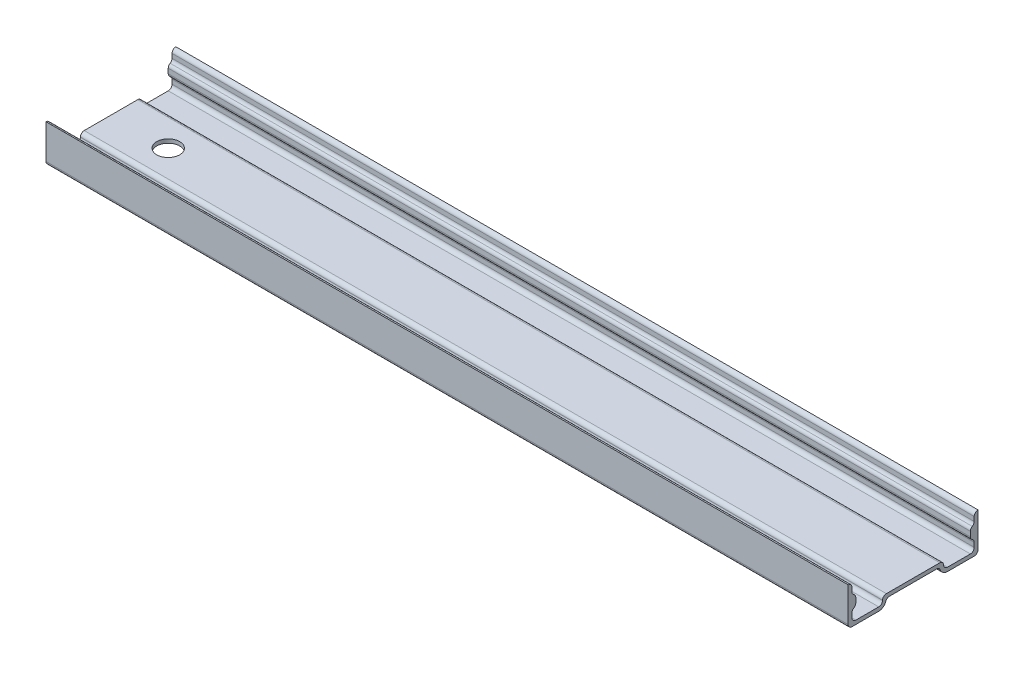
from build123d import *

# Parameters (mm, degrees)
SKETCH1_W           = 210
SKETCH1_H           = 34
BOSS_EXTRUDE1_DEPTH = 1
SKETCH2_W           = 210
SKETCH2_H           = 1
BOSS_EXTRUDE2_DEPTH = 9
SKETCH3_W           = 210
SKETCH3_H           = 16
BOSS_EXTRUDE3_DEPTH = 2
FILLET1_R           = 1
FILLET2_R           = 1
FILLET3_R           = 1
FILLET4_R           = 1
FILLET5_R           = 1
FILLET6_R           = 1
CUT_EXTRUDE1_DEPTH  = 211.924156985
FILLET7_R           = 1
FILLET8_R           = 1
FILLET9_R           = 1
FILLET10_R          = 1
SKETCH5_W           = 3
SKETCH5_H           = 3
BOSS_EXTRUDE4_DEPTH = 210
FILLET11_R          = 1
FILLET12_R          = 1
FILLET13_R          = 1
FILLET14_R          = 1
FILLET15_R          = 1
FILLET16_R          = 1
FILLET17_R          = 1
FILLET18_R          = 1
SKETCH6_W           = 1
SKETCH6_H           = 3
CUT_EXTRUDE2_DEPTH  = 210
SKETCH7_R           = 3
CUT_EXTRUDE3_DEPTH  = 10


with BuildPart() as part:
    # Sketch1 → Boss-Extrude1 (new body)
    with BuildSketch(Plane(origin=(0, 0, 0), x_dir=(1, 0, 0), z_dir=(0, 1, 0))):
        Rectangle(SKETCH1_W, SKETCH1_H)
    extrude(amount=BOSS_EXTRUDE1_DEPTH)

    # Sketch2 → Boss-Extrude2 (add)
    with BuildSketch(Plane(origin=(0, 1, 0), x_dir=(1, 0, 0), z_dir=(0, 1, 0))):
        with Locations((0, 16.5)):
            Rectangle(SKETCH2_W, SKETCH2_H)
        with Locations((0, -16.5)):
            Rectangle(SKETCH2_W, SKETCH2_H)
    extrude(amount=BOSS_EXTRUDE2_DEPTH)

    # Sketch3 → Boss-Extrude3 (add)
    with BuildSketch(Plane(origin=(0, 1, 0), x_dir=(1, 0, 0), z_dir=(0, 1, 0))):
        Rectangle(SKETCH3_W, SKETCH3_H)
    extrude(amount=BOSS_EXTRUDE3_DEPTH)

    # Fillet1
    fillet1_edges = [part.edges().sort_by_distance(p)[0] for p in [
        (0, 1, 8),
    ]]
    fillet(fillet1_edges, radius=FILLET1_R)

    # Fillet2
    fillet2_edges = [part.edges().sort_by_distance(p)[0] for p in [
        (0, 1, -8),
    ]]
    fillet(fillet2_edges, radius=FILLET2_R)

    # Fillet3
    fillet3_edges = [part.edges().sort_by_distance(p)[0] for p in [
        (0, 1, 16),
    ]]
    fillet(fillet3_edges, radius=FILLET3_R)

    # Fillet4
    fillet4_edges = [part.edges().sort_by_distance(p)[0] for p in [
        (0, 1, -16),
    ]]
    fillet(fillet4_edges, radius=FILLET4_R)

    # Fillet5
    fillet5_edges = [part.edges().sort_by_distance(p)[0] for p in [
        (0, 10, -16),
    ]]
    fillet(fillet5_edges, radius=FILLET5_R - 0.0001)  # a hair under: the kernel refuses the full size

    # Fillet6
    fillet6_edges = [part.edges().sort_by_distance(p)[0] for p in [
        (0, 10, 16),
    ]]
    fillet(fillet6_edges, radius=FILLET6_R - 0.0001)  # a hair under: the kernel refuses the full size

    # Sketch4 → Cut-Extrude1 (cut, through all)
    with BuildSketch(Plane(origin=(105, 0, 0), x_dir=(0, 0, -1), z_dir=(1, 0, 0))):
        with BuildLine():
            Line((-9, 0), (9, 0))
            ThreePointArc((9, 0), (7.845299462, 0.367006838), (7.114381917, 1.333333333))
            ThreePointArc((7.114381917, 1.333333333), (6.748923144, 1.816496581), (6.171572875, 2))
            Line((6.171572875, 2), (-6.171572875, 2))
            ThreePointArc((-6.171572875, 2), (-6.748923144, 1.816496581), (-7.114381917, 1.333333333))
            ThreePointArc((-7.114381917, 1.333333333), (-7.845299462, 0.367006838), (-9, 0))
        make_face()
    extrude(amount=-CUT_EXTRUDE1_DEPTH, mode=Mode.SUBTRACT)

    # Fillet7
    fillet7_edges = [part.edges().sort_by_distance(p)[0] for p in [
        (0, 3, 8),
    ]]
    fillet(fillet7_edges, radius=FILLET7_R - 0.0001)  # a hair under: the kernel refuses the full size

    # Fillet8
    fillet8_edges = [part.edges().sort_by_distance(p)[0] for p in [
        (0, 3, -8),
    ]]
    fillet(fillet8_edges, radius=FILLET8_R - 0.0001)  # a hair under: the kernel refuses the full size

    # Fillet9
    fillet9_edges = [part.edges().sort_by_distance(p)[0] for p in [
        (0, 0, -17),
    ]]
    fillet(fillet9_edges, radius=FILLET9_R)

    # Fillet10
    fillet10_edges = [part.edges().sort_by_distance(p)[0] for p in [
        (0, 0, 17),
    ]]
    fillet(fillet10_edges, radius=FILLET10_R)

    # Sketch5 → Boss-Extrude4 (add)
    with BuildSketch(Plane(origin=(105, 0, 0), x_dir=(0, 0, -1), z_dir=(1, 0, 0))):
        with Locations((-16.5, 5.371770908)):
            Rectangle(SKETCH5_W, SKETCH5_H)
        with Locations((16.5, 5.371770908)):
            Rectangle(SKETCH5_W, SKETCH5_H)
    extrude(amount=-BOSS_EXTRUDE4_DEPTH)

    # Fillet11
    fillet11_edges = [part.edges().sort_by_distance(p)[0] for p in [
        (0, 6.871770908, 16),
    ]]
    fillet(fillet11_edges, radius=FILLET11_R - 0.0001)  # a hair under: the kernel refuses the full size

    # Fillet12
    fillet12_edges = [part.edges().sort_by_distance(p)[0] for p in [
        (0, 6.871770908, 15),
    ]]
    fillet(fillet12_edges, radius=FILLET12_R)

    # Fillet13
    fillet13_edges = [part.edges().sort_by_distance(p)[0] for p in [
        (0, 3.871770908, 15),
    ]]
    fillet(fillet13_edges, radius=FILLET13_R - 0.0001)  # a hair under: the kernel refuses the full size

    # Fillet14
    fillet14_edges = [part.edges().sort_by_distance(p)[0] for p in [
        (0, 3.871770908, 16),
    ]]
    fillet(fillet14_edges, radius=FILLET14_R)

    # Fillet15
    fillet15_edges = [part.edges().sort_by_distance(p)[0] for p in [
        (0, 6.871770908, -16),
    ]]
    fillet(fillet15_edges, radius=FILLET15_R - 0.0001)  # a hair under: the kernel refuses the full size

    # Fillet16
    fillet16_edges = [part.edges().sort_by_distance(p)[0] for p in [
        (0, 6.871770908, -15),
    ]]
    fillet(fillet16_edges, radius=FILLET16_R)

    # Fillet17
    fillet17_edges = [part.edges().sort_by_distance(p)[0] for p in [
        (0, 3.871770908, -15),
    ]]
    fillet(fillet17_edges, radius=FILLET17_R - 0.0001)  # a hair under: the kernel refuses the full size

    # Fillet18
    fillet18_edges = [part.edges().sort_by_distance(p)[0] for p in [
        (0, 3.871770908, -16),
    ]]
    fillet(fillet18_edges, radius=FILLET18_R)

    # Sketch6 → Cut-Extrude2 (cut)
    with BuildSketch(Plane(origin=(105, 0, 0), x_dir=(0, 0, -1), z_dir=(1, 0, 0))):
        with Locations((-17.5, 5.371770908)):
            Rectangle(SKETCH6_W, SKETCH6_H)
        with Locations((17.5, 5.371770908)):
            Rectangle(SKETCH6_W, SKETCH6_H)
    extrude(amount=-CUT_EXTRUDE2_DEPTH, mode=Mode.SUBTRACT)

    # Sketch7 → Cut-Extrude3 (cut)
    with BuildSketch(Plane.XZ.offset(-2)):
        with Locations(Location((-90, 0, 0), (0, 0, 270))):
            Circle(SKETCH7_R)
    extrude(amount=-CUT_EXTRUDE3_DEPTH, mode=Mode.SUBTRACT)


solid = part.part
